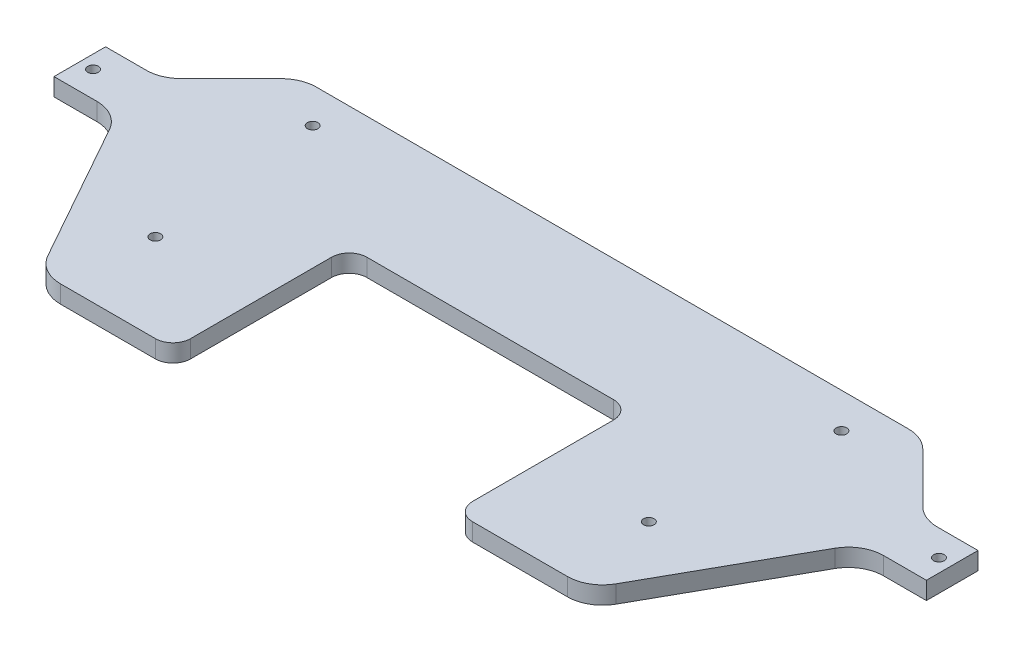
from build123d import *

# Parameters (mm, degrees)
SALIENTE_EXTRUIR1_DEPTH = 5
REDONDEO1_R             = 10
CROQUIS2_R              = 1.5
CORTAR_EXTRUIR1_DEPTH   = 135.669558943
CROQUIS4_W              = 80
CROQUIS4_H              = 50
CORTAR_EXTRUIR2_DEPTH   = 135.669558943
REDONDEO2_R             = 5
CROQUIS5_W              = 4
CROQUIS5_H              = 14.636342218
CORTAR_EXTRUIR3_DEPTH   = 135.669558943


with BuildPart() as part:
    # Croquis1 → Saliente-Extruir1 (new body)
    with BuildSketch(Plane(origin=(0, 0, 0), x_dir=(1, 0, 0), z_dir=(0, 1, 0))):
        Polygon((-88.1, 42.318171109), (88.1, 42.318171109), (108.1, 22.318171109), (127.75, 22.318171109), (127.75, 7.681828891), (105.75, 7.681828891), (77.75, -42.318171109), (-77.75, -42.318171109), (-105.75, 7.681828891), (-127.75, 7.681828891), (-127.75, 22.318171109), (-108.1, 22.318171109), align=None)
    extrude(amount=SALIENTE_EXTRUIR1_DEPTH)

    # Redondeo1
    redondeo1_edges = [part.edges().sort_by_distance(p)[0] for p in [
        (88.1, 2.5, -42.318171109),
        (-88.1, 2.5, -42.318171109),
        (-77.75, 2.5, 42.318171109),
        (77.75, 2.5, 42.318171109),
        (108.1, 2.5, -22.318171109),
        (105.75, 2.5, -7.681828891),
        (-105.75, 2.5, -7.681828891),
        (-108.1, 2.5, -22.318171109),
    ]]
    fillet(redondeo1_edges, radius=REDONDEO1_R)

    # Croquis2 → Cortar-Extruir1 (cut, through all)
    with BuildSketch(Plane(origin=(0, 5, 0), x_dir=(1, 0, 0), z_dir=(0, 1, 0))):
        with Locations((70, -17.318171109)):
            Circle(CROQUIS2_R)
        with Locations((-70, -17.318171109)):
            Circle(CROQUIS2_R)
        with Locations((-119.996067812, 15)):
            Circle(CROQUIS2_R)
        with Locations((119.996067812, 15)):
            Circle(CROQUIS2_R)
        with Locations((-75, 32.318171109)):
            Circle(CROQUIS2_R)
        with Locations((75, 32.318171109)):
            Circle(CROQUIS2_R)
        with Locations((-17.5, -17.318171109)):
            Circle(CROQUIS2_R)
        with Locations((17.5, -17.318171109)):
            Circle(CROQUIS2_R)
        with Locations((-17.5, -37.318171109)):
            Circle(CROQUIS2_R)
        with Locations((17.5, -37.318171109)):
            Circle(CROQUIS2_R)
    extrude(amount=-CORTAR_EXTRUIR1_DEPTH, mode=Mode.SUBTRACT)

    # Croquis4 → Cortar-Extruir2 (cut, through all)
    with BuildSketch(Plane(origin=(0, 5, 0), x_dir=(1, 0, 0), z_dir=(0, 1, 0))):
        with Locations((0, -17.318171109)):
            Rectangle(CROQUIS4_W, CROQUIS4_H)
    extrude(amount=-CORTAR_EXTRUIR2_DEPTH, mode=Mode.SUBTRACT)

    # Redondeo2
    redondeo2_edges = [part.edges().sort_by_distance(p)[0] for p in [
        (-40, 2.5, 42.318171109),
        (40, 2.5, 42.318171109),
        (40, 2.5, -7.681828891),
        (-40, 2.5, -7.681828891),
    ]]
    fillet(redondeo2_edges, radius=REDONDEO2_R)

    # Croquis5 → Cortar-Extruir3 (cut, through all)
    with BuildSketch(Plane(origin=(0, 5, 0), x_dir=(1, 0, 0), z_dir=(0, 1, 0))):
        with Locations((-125.75, 15)):
            Rectangle(CROQUIS5_W, CROQUIS5_H)
        with Locations((125.75, 15)):
            Rectangle(CROQUIS5_W, CROQUIS5_H)
    extrude(amount=-CORTAR_EXTRUIR3_DEPTH, mode=Mode.SUBTRACT)


solid = part.part
